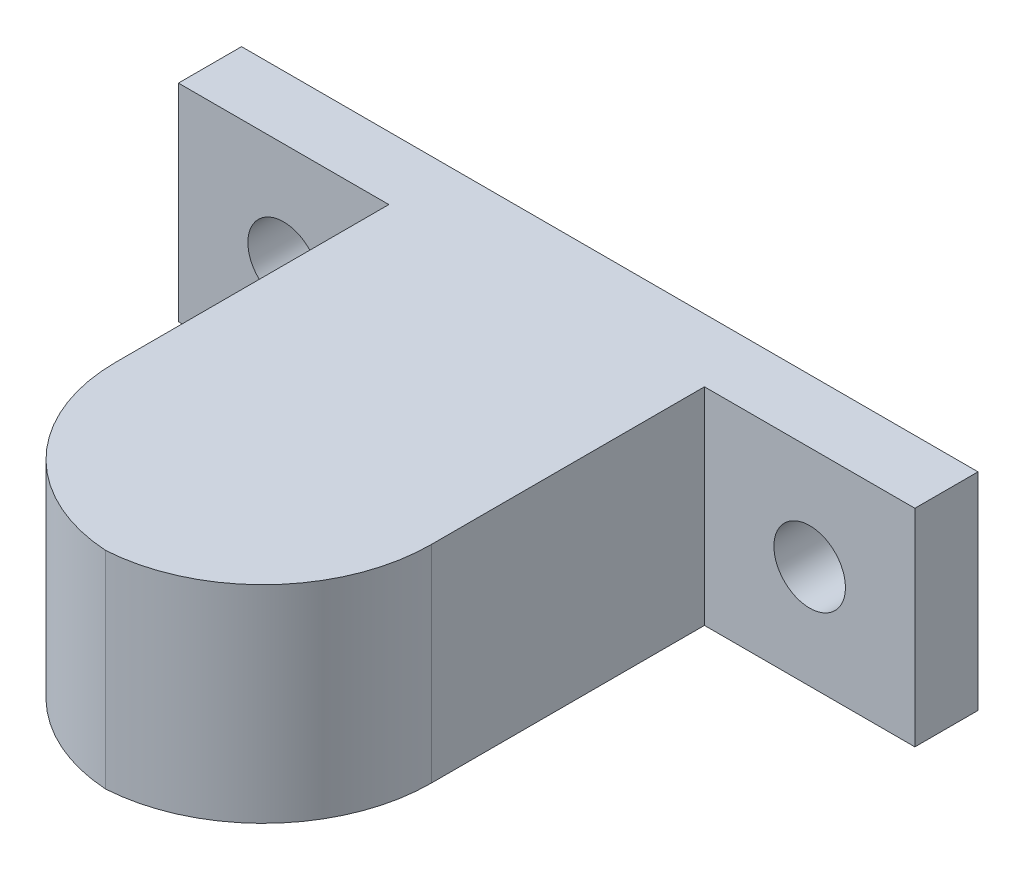
from build123d import *

# Parameters (mm, degrees)
BOSS_EXTRUDE1_DEPTH = 3
SKETCH2_W           = 15
SKETCH2_H           = 21.14750363
BOSS_EXTRUDE2_DEPTH = 9.822712027
FILLET1_R           = 8
CUT_EXTRUDE1_START  = -7.2
SKETCH3_R           = 4.1
CUT_EXTRUDE1_DEPTH  = 7.2


with BuildPart() as part:
    # Sketch1 → Boss-Extrude1 (new body)
    with BuildSketch(Plane.XY):
        with BuildLine():
            Line((-241.35, 304.622712027), (-266.35, 304.622712027))
            Line((-266.35, 304.622712027), (-266.35, 301.411356013))
            ThreePointArc((-266.35, 301.411356013), (-265.147918472, 300.913437541), (-264.65, 299.711356013))
            ThreePointArc((-264.65, 299.711356013), (-265.147918472, 298.509274485), (-266.35, 298.011356013))
            Line((-266.35, 298.011356013), (-266.35, 294.8))
            Line((-266.35, 294.8), (-241.35, 294.8))
            Line((-241.35, 294.8), (-241.35, 298.011356013))
            ThreePointArc((-241.35, 298.011356013), (-243.05, 299.711356013), (-241.35, 301.411356013))
            Line((-241.35, 301.411356013), (-241.35, 304.622712027))
        make_face()
        with BuildLine():
            Line((-266.35, 304.622712027), (-271.35, 304.622712027))
            Line((-271.35, 304.622712027), (-271.35, 294.8))
            Line((-271.35, 294.8), (-269.799999998, 294.8))
            Line((-269.799999998, 294.8), (-266.35, 294.8))
            Line((-266.35, 294.8), (-266.35, 298.011356013))
            ThreePointArc((-266.35, 298.011356013), (-268.05, 299.711356013), (-266.35, 301.411356013))
            Line((-266.35, 301.411356013), (-266.35, 304.622712027))
        make_face()
        with BuildLine():
            Line((-236.35, 304.622712027), (-241.35, 304.622712027))
            Line((-241.35, 304.622712027), (-241.35, 301.411356013))
            ThreePointArc((-241.35, 301.411356013), (-240.147918472, 300.913437541), (-239.65, 299.711356013))
            ThreePointArc((-239.65, 299.711356013), (-240.147918472, 298.509274485), (-241.35, 298.011356013))
            Line((-241.35, 298.011356013), (-241.35, 294.8))
            Line((-241.35, 294.8), (-236.35, 294.8))
            Line((-236.35, 294.8), (-236.35, 304.622712027))
        make_face()
    extrude(amount=BOSS_EXTRUDE1_DEPTH)

    # Sketch2 → Boss-Extrude2 (add)
    with BuildSketch(Plane(origin=(0, 304.622712027, 0), x_dir=(1, 0, 0), z_dir=(0, 1, 0))):
        with Locations((-253.85, -13.407165318)):
            Rectangle(SKETCH2_W, SKETCH2_H)
    extrude(amount=-BOSS_EXTRUDE2_DEPTH)

    # Fillet1
    # the kernel refuses this fillet: 8 mm, written as the material it takes off along each edge
    with BuildSketch(Plane(origin=(-246.35, 324.622712027, 23.980917133), x_dir=(0, 0, -1), z_dir=(0, -1, 0))) as fillet1_piece_1:
        with BuildLine():
            CenterArc((FILLET1_R, -FILLET1_R), FILLET1_R, 90, 90)
            Line((0, -FILLET1_R), (0, 0))
            Line((0, 0), (FILLET1_R, 0))
        make_face()
    extrude(amount=49.822712027, mode=Mode.SUBTRACT)
    with BuildSketch(Plane(origin=(-261.35, 324.622712027, 23.980917133), x_dir=(0, 0, -1), z_dir=(0, -1, 0))) as fillet1_piece_2:
        with BuildLine():
            CenterArc((FILLET1_R, FILLET1_R), FILLET1_R, 180, 90)
            Line((0, FILLET1_R), (0, 0))
            Line((0, 0), (FILLET1_R, 0))
        make_face()
    extrude(amount=49.822712027, mode=Mode.SUBTRACT)

    # Sketch3 → Cut-Extrude1 (cut)
    with BuildSketch(Plane.XZ.offset(-294.8).offset(CUT_EXTRUDE1_START)):
        with Locations((-253.85, 16.5)):
            Circle(SKETCH3_R)
    extrude(amount=CUT_EXTRUDE1_DEPTH, mode=Mode.SUBTRACT)


solid = part.part
